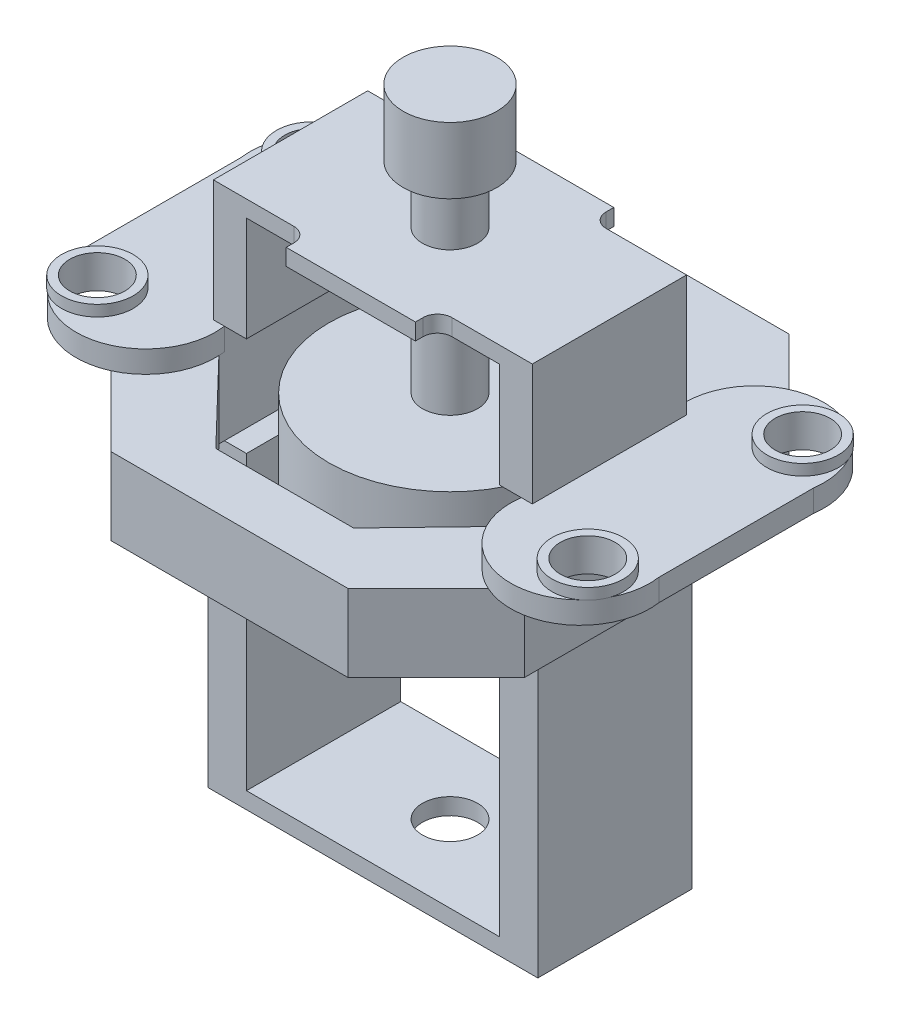
from build123d import *

# Parameters (mm, degrees)
SALIENTE_EXTRUIR1_DEPTH  = 14
CROQUIS4_R               = 22
SALIENTE_EXTRUIR2_DEPTH  = 15
CROQUIS5_R               = 5
SALIENTE_EXTRUIR3_DEPTH  = 4
CROQUIS7_R               = 6.5
CROQUIS7_R_2             = 5
SALIENTE_EXTRUIR4_DEPTH  = 2
SALIENTE_EXTRUIR5_DEPTH  = 19
CROQUIS9_R               = 5
SALIENTE_EXTRUIR6_DEPTH  = 3
CROQUIS10_R              = 5
SALIENTE_EXTRUIR7_DEPTH  = 36.5
CROQUIS12_R              = 8.5
SALIENTE_EXTRUIR8_DEPTH  = 12
SALIENTE_EXTRUIR9_DEPTH  = 53
SALIENTE_EXTRUIR10_START = 3
CROQUIS14_W              = 59.880061862
CROQUIS14_H              = 28
CROQUIS14_R              = 5
SALIENTE_EXTRUIR10_DEPTH = 3


with BuildPart() as part:
    # Croquis2 → Saliente-Extruir1 (new body)
    with BuildSketch(Plane(origin=(0, 0, 0), x_dir=(1, 0, 0), z_dir=(0, 1, 0))):
        Polygon((43, 0), (0, 0), (-16, -16), (-16, -64), (0, -80), (21.5, -80), (43, -80), (59, -64), (59, -16), align=None)
        Polygon((48.440030931, -25), (48.440030931, -55), (34, -70), (9, -70), (-5.440030931, -55), (-5.440030931, -25), (9, -10), (34, -10), align=None, mode=Mode.SUBTRACT)
    extrude(amount=SALIENTE_EXTRUIR1_DEPTH)

    # Croquis5 → Saliente-Extruir3 (add)
    # profile 1 of 2: a face of its own
    with BuildSketch(Plane(origin=(0, 14, 0), x_dir=(1, 0, 0), z_dir=(0, 1, 0))):
        with BuildLine():
            Line((-30.440030931, -26), (-30.440030931, -54))
            ThreePointArc((-30.440030931, -54), (-17.940030931, -68.416978851), (-5.440030931, -54))
            Line((-5.440030931, -54), (-5.440030931, -26))
            ThreePointArc((-5.440030931, -26), (-17.940030931, -11.583021149), (-30.440030931, -26))
        make_face()
        with Locations((-23, -59.5)):
            Circle(CROQUIS5_R, mode=Mode.SUBTRACT)
        with Locations((-23, -20.5)):
            Circle(CROQUIS5_R, mode=Mode.SUBTRACT)
    # profile 2 of 2: a face of its own
    with BuildSketch(Plane(origin=(0, 14, 0), x_dir=(1, 0, 0), z_dir=(0, 1, 0))):
        with BuildLine():
            Line((48.440030931, -26), (48.440030931, -54))
            ThreePointArc((48.440030931, -54), (60.940030931, -68.416978851), (73.440030931, -54))
            Line((73.440030931, -54), (73.440030931, -26))
            ThreePointArc((73.440030931, -26), (60.940030931, -11.583021149), (48.440030931, -26))
        make_face()
        with Locations((66, -20.5)):
            Circle(CROQUIS5_R, mode=Mode.SUBTRACT)
        with Locations((66, -59.5)):
            Circle(CROQUIS5_R, mode=Mode.SUBTRACT)
    extrude(amount=SALIENTE_EXTRUIR3_DEPTH)

    # Croquis7 → Saliente-Extruir4 (add)
    # profile 1 of 4: a face of its own
    with BuildSketch(Plane(origin=(0, 18, 0), x_dir=(1, 0, 0), z_dir=(0, 1, 0))):
        with Locations((-23, -20.5)):
            Circle(CROQUIS7_R)
        with Locations((-23, -20.5)):
            Circle(CROQUIS7_R_2, mode=Mode.SUBTRACT)
    # profile 2 of 4: a face of its own
    with BuildSketch(Plane(origin=(0, 18, 0), x_dir=(1, 0, 0), z_dir=(0, 1, 0))):
        with Locations((-23, -59.5)):
            Circle(CROQUIS7_R)
        with Locations((-23, -59.5)):
            Circle(CROQUIS7_R_2, mode=Mode.SUBTRACT)
    # profile 3 of 4: a face of its own
    with BuildSketch(Plane(origin=(0, 18, 0), x_dir=(1, 0, 0), z_dir=(0, 1, 0))):
        with Locations((66, -59.5)):
            Circle(CROQUIS7_R)
        with Locations((66, -59.5)):
            Circle(CROQUIS7_R_2, mode=Mode.SUBTRACT)
    # profile 4 of 4: a face of its own
    with BuildSketch(Plane(origin=(0, 18, 0), x_dir=(1, 0, 0), z_dir=(0, 1, 0))):
        with Locations((66, -20.5)):
            Circle(CROQUIS7_R)
        with Locations((66, -20.5)):
            Circle(CROQUIS7_R_2, mode=Mode.SUBTRACT)
    extrude(amount=SALIENTE_EXTRUIR4_DEPTH)

    # Croquis8 → Saliente-Extruir5 (add)
    with BuildSketch(Plane(origin=(0, 18, 0), x_dir=(1, 0, 0), z_dir=(0, 1, 0))):
        Polygon((-5.440030931, -26), (-1.440030931, -26), (-1.440030931, -54), (-5.440030931, -54), (-7.440030931, -54), (-7.440030931, -26), align=None)
        Polygon((50.440030931, -54), (48.440030931, -54), (44.440030931, -54), (44.440030931, -26), (48.440030931, -26), (50.440030931, -26), align=None)
    extrude(amount=SALIENTE_EXTRUIR5_DEPTH)

    # Croquis9 → Saliente-Extruir6 (add)
    with BuildSketch(Plane(origin=(0, 37, 0), x_dir=(1, 0, 0), z_dir=(0, 1, 0))):
        with BuildLine():
            Line((-7.440030931, -26), (7.17351898, -26))
            ThreePointArc((7.17351898, -26), (9.011002532, -25.238889392), (9.77211314, -23.40140584))
            Line((9.77211314, -23.40140584), (9.77211314, -22.000951417))
            Line((9.77211314, -22.000951417), (33.22788686, -22.000951417))
            Line((33.22788686, -22.000951417), (33.22788686, -23.40140584))
            ThreePointArc((33.22788686, -23.40140584), (33.988997468, -25.238889392), (35.82648102, -26))
            Line((35.82648102, -26), (50.440030931, -26))
            Line((50.440030931, -26), (50.440030931, -54))
            Line((50.440030931, -54), (35.82648102, -54))
            ThreePointArc((35.82648102, -54), (33.988997468, -54.761110608), (33.22788686, -56.59859416))
            Line((33.22788686, -56.59859416), (33.22788686, -57.999048583))
            Line((33.22788686, -57.999048583), (9.77211314, -57.999048583))
            Line((9.77211314, -57.999048583), (9.77211314, -56.59859416))
            ThreePointArc((9.77211314, -56.59859416), (9.011002532, -54.761110608), (7.17351898, -54))
            Line((7.17351898, -54), (-7.440030931, -54))
            Line((-7.440030931, -54), (-7.440030931, -26))
        make_face()
        with Locations((21.5, -40)):
            Circle(CROQUIS9_R, mode=Mode.SUBTRACT)
    extrude(amount=SALIENTE_EXTRUIR6_DEPTH)



with BuildPart() as body_2:
    # Croquis4 → Saliente-Extruir2 (new body)
    with BuildSketch(Plane(origin=(0, 14, 0), x_dir=(1, 0, 0), z_dir=(0, 1, 0))):
        with Locations((21.5, -40)):
            Circle(CROQUIS4_R)
    extrude(amount=-SALIENTE_EXTRUIR2_DEPTH)


with BuildPart() as part_1:
    add(part.part)

    add(body_2.part)  # Saliente-Extruir7 merges body 2
    # Croquis10 → Saliente-Extruir7 (add)
    with BuildSketch(Plane(origin=(0, 14, 0), x_dir=(1, 0, 0), z_dir=(0, 1, 0))):
        with Locations((21.5, -40)):
            Circle(CROQUIS10_R)
    extrude(amount=SALIENTE_EXTRUIR7_DEPTH)

    # Croquis12 → Saliente-Extruir8 (add)
    with BuildSketch(Plane(origin=(0, 50.5, 0), x_dir=(1, 0, 0), z_dir=(0, 1, 0))):
        with Locations((21.5, -40)):
            Circle(CROQUIS12_R)
    extrude(amount=SALIENTE_EXTRUIR8_DEPTH)

    # Croquis13 → Saliente-Extruir9 (add)
    with BuildSketch(Plane.XZ):
        Polygon((-5.440030931, 54), (-1.440030931, 54), (-1.440030931, 26), (-5.440030931, 26), (-8.440030931, 26), (-8.440030931, 54), align=None)
        Polygon((48.440030931, 54), (51.440030931, 54), (51.440030931, 26), (44.440030931, 26), (44.440030931, 54), align=None)
    extrude(amount=SALIENTE_EXTRUIR9_DEPTH)

    # Croquis14 → Saliente-Extruir10 (add)
    with BuildSketch(Plane.XZ.offset(53).offset(SALIENTE_EXTRUIR10_START)):
        with Locations((21.5, 40)):
            Rectangle(CROQUIS14_W, CROQUIS14_H)
        with Locations((21.5, 40)):
            Circle(CROQUIS14_R, mode=Mode.SUBTRACT)
    extrude(amount=-SALIENTE_EXTRUIR10_DEPTH)


solid = part_1.part
